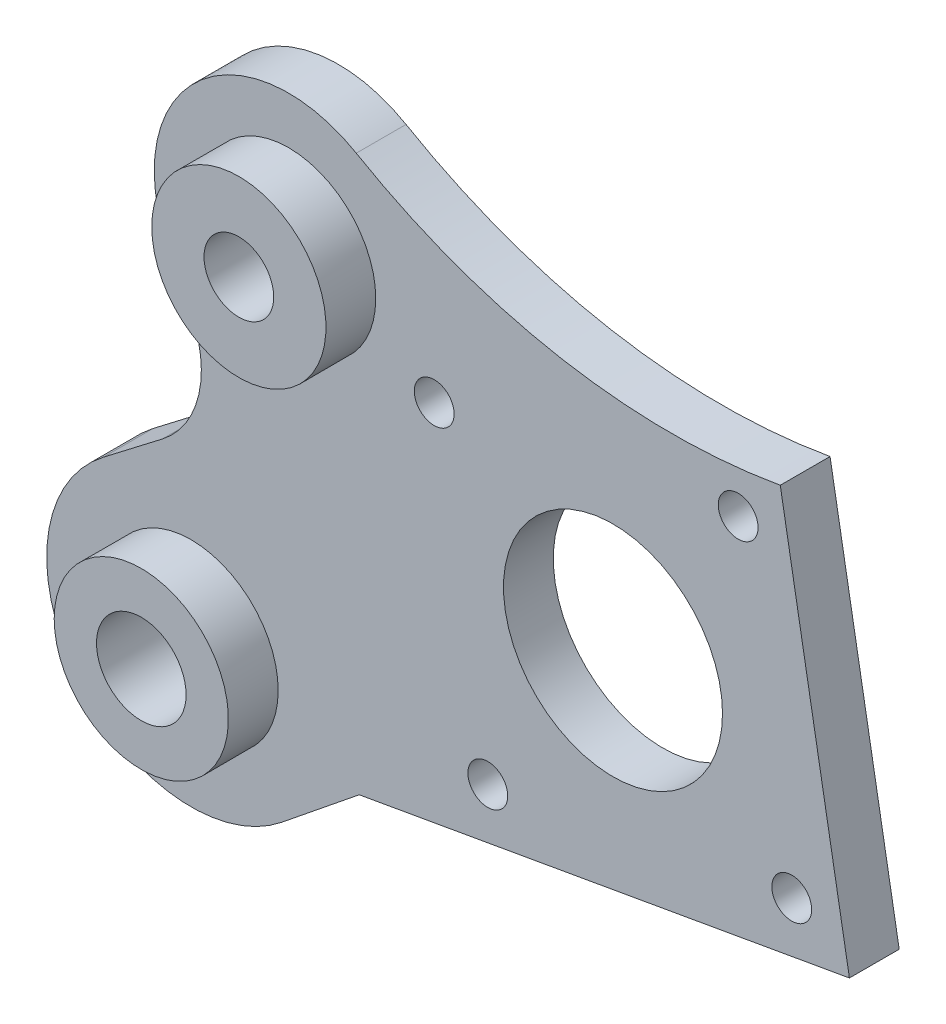
from build123d import *

# Parameters (mm, degrees)
SKETCH1_R           = 3.5
SKETCH1_R_2         = 4.5
BOSS_EXTRUDE1_DEPTH = 5
BOSS_EXTRUDE2_START = -5
SKETCH2_R           = 8.75
SKETCH2_R_2         = 3.5
SKETCH2_R_3         = 4.5
BOSS_EXTRUDE2_DEPTH = 5
SKETCH4_R           = 2
SKETCH4_R_2         = 11
CUT_EXTRUDE1_DEPTH  = 78.847857167


with BuildPart() as part:
    # Sketch1 → Boss-Extrude1 (new body)
    with BuildSketch(Plane.XY):
        with BuildLine():
            Line((-12.068862554, -6.04917818), (-9.828426191, -10.519127274))
            ThreePointArc((-9.828426191, -10.519127274), (-9.022245749, -17.239185417), (-12.680657026, -22.933492686))
            Line((-12.680657026, -22.933492686), (-18.627117662, -27.496435605))
            ThreePointArc((-18.627117662, -27.496435605), (-21.193595331, -47.96861112), (-0.691265287, -50.281886009))
            Line((-0.691265287, -50.281886009), (7.089345754, -44))
            Line((7.089345754, -44), (56.329733405, -35.317591117))
            Line((56.329733405, -35.317591117), (49.383806298, 4.074719004))
            ThreePointArc((49.383806298, 4.074719004), (27.415676639, 4.095127832), (6.793399239, 11.666178757))
            ThreePointArc((6.793399239, 11.666178757), (-9.24208289, 9.840421935), (-12.068862554, -6.04917818))
        make_face()
        Circle(SKETCH1_R, mode=Mode.SUBTRACT)
        with Locations((-9.8, -39)):
            Circle(SKETCH1_R_2, mode=Mode.SUBTRACT)
    extrude(amount=-BOSS_EXTRUDE1_DEPTH)

    # Sketch2 → Boss-Extrude2 (add)
    # profile 1 of 2: a face of its own
    with BuildSketch(Plane(origin=(0, 0, 0), x_dir=(-1, 0, 0), z_dir=(0, 0, -1)).offset(BOSS_EXTRUDE2_START)):
        Circle(SKETCH2_R)
        Circle(SKETCH2_R_2, mode=Mode.SUBTRACT)
    # profile 2 of 2: a face of its own
    with BuildSketch(Plane(origin=(0, 0, 0), x_dir=(-1, 0, 0), z_dir=(0, 0, -1)).offset(BOSS_EXTRUDE2_START)):
        with Locations((9.8, -39)):
            Circle(SKETCH2_R)
        with Locations((9.8, -39)):
            Circle(SKETCH2_R_3, mode=Mode.SUBTRACT)
    extrude(amount=BOSS_EXTRUDE2_DEPTH)

    # Sketch4 → Cut-Extrude1 (cut, through all)
    with BuildSketch(Plane.XY):
        with Locations((14.6253199, -6.115846404)):
            Circle(SKETCH4_R)
        with Locations((20.008413408, -36.644886748)):
            Circle(SKETCH4_R)
        with Locations((50.537453751, -31.26179324)):
            Circle(SKETCH4_R)
        with Locations((45.154360244, -0.732752897)):
            Circle(SKETCH4_R)
        with Locations((32.581386826, -18.688819822)):
            Circle(SKETCH4_R_2)
    extrude(amount=-CUT_EXTRUDE1_DEPTH, mode=Mode.SUBTRACT)


solid = part.part
